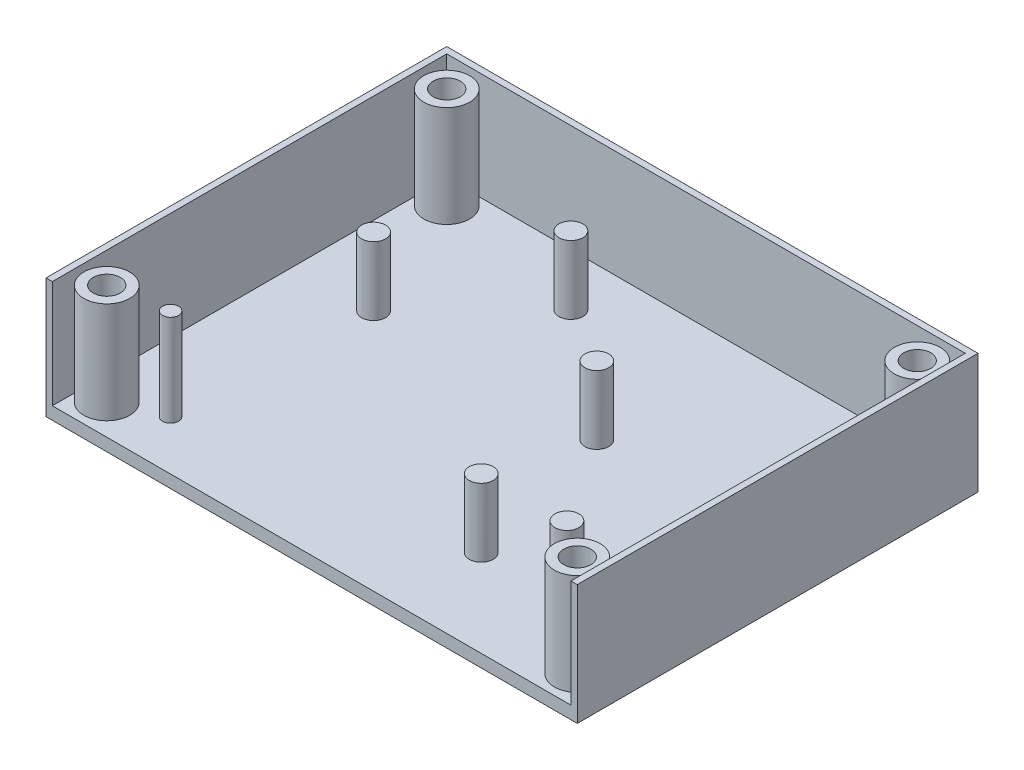
from build123d import *

# Parameters (mm, degrees)
BOSS_EXTRUDE12_DEPTH = 3.175
BOSS_EXTRUDE13_DEPTH = 30.1625
SKETCH1_25_R         = 5.75
SKETCH1_25_R_2       = 3.4
BOSS_EXTRUDE15_DEPTH = 28.575
SKETCH1_27_R         = 3.4
CUT_EXTRUDE3_DEPTH   = 28.575
CHAMFER2_SIZE        = 1.45
SKETCH1_28_R         = 3
BOSS_EXTRUDE16_DEPTH = 20.32
SKETCH1_29_R         = 2
BOSS_EXTRUDE17_DEPTH = 26.1874


with BuildPart() as part:
    # Sketch1 → Boss-Extrude12 (new body)
    with BuildSketch(Plane(origin=(0, 0, 0), x_dir=(1, 0, 0), z_dir=(0, 1, 0))):
        Polygon((-66.858315384, -50.276221126), (-65.270815384, -50.276221126), (64.85543465, -50.276221126), (66.44293465, -50.276221126), (66.44293465, 50.266274766), (-66.858315384, 50.266274766), align=None)
    extrude(amount=BOSS_EXTRUDE12_DEPTH)

    # Sketch1<23> → Boss-Extrude13 (add)
    with BuildSketch(Plane(origin=(0, 0, 0), x_dir=(1, 0, 0), z_dir=(0, 1, 0))):
        Polygon((-66.858315384, 50.266274766), (-66.858315384, -50.276221126), (-65.270815384, -50.276221126), (-65.270815384, 48.678774766), (64.85543465, 48.678774766), (64.85543465, -50.276221126), (66.44293465, -50.276221126), (66.44293465, 50.266274766), align=None)
    extrude(amount=BOSS_EXTRUDE13_DEPTH)

    # Sketch1<25> → Boss-Extrude15 (add)
    # profile 1 of 4: a face of its own
    with BuildSketch(Plane(origin=(0, 0, 0), x_dir=(1, 0, 0), z_dir=(0, 1, 0))):
        with Locations((-59.238315384, 42.646274766)):
            Circle(SKETCH1_25_R)
        with Locations((-59.238315384, 42.646274766)):
            Circle(SKETCH1_25_R_2, mode=Mode.SUBTRACT)
    # profile 2 of 4: a face of its own
    with BuildSketch(Plane(origin=(0, 0, 0), x_dir=(1, 0, 0), z_dir=(0, 1, 0))):
        with Locations((58.82293465, 42.646274766)):
            Circle(SKETCH1_25_R)
        with Locations((58.82293465, 42.646274766)):
            Circle(SKETCH1_25_R_2, mode=Mode.SUBTRACT)
    # profile 3 of 4: a face of its own
    with BuildSketch(Plane(origin=(0, 0, 0), x_dir=(1, 0, 0), z_dir=(0, 1, 0))):
        with Locations((-59.238315384, -42.656221126)):
            Circle(SKETCH1_25_R)
        with Locations((-59.238315384, -42.656221126)):
            Circle(SKETCH1_25_R_2, mode=Mode.SUBTRACT)
    # profile 4 of 4: a face of its own
    with BuildSketch(Plane(origin=(0, 0, 0), x_dir=(1, 0, 0), z_dir=(0, 1, 0))):
        with Locations((58.82293465, -42.656221126)):
            Circle(SKETCH1_25_R)
        with Locations((58.82293465, -42.656221126)):
            Circle(SKETCH1_25_R_2, mode=Mode.SUBTRACT)
    extrude(amount=BOSS_EXTRUDE15_DEPTH)

    # Sketch1<27> → Cut-Extrude3 (cut)
    with BuildSketch(Plane(origin=(0, 0, 0), x_dir=(1, 0, 0), z_dir=(0, 1, 0))):
        with Locations((-59.238315384, 42.646274766)):
            Circle(SKETCH1_27_R)
        with Locations((58.82293465, 42.646274766)):
            Circle(SKETCH1_27_R)
        with Locations((-59.238315384, -42.656221126)):
            Circle(SKETCH1_27_R)
        with Locations((58.82293465, -42.656221126)):
            Circle(SKETCH1_27_R)
    extrude(amount=CUT_EXTRUDE3_DEPTH, mode=Mode.SUBTRACT)

    # Chamfer2
    chamfer2_edges = [part.edges().sort_by_distance(p)[0] for p in [
        (55.42293465, 0, 42.656221126),
        (55.42293465, 0, -42.646274766),
        (-62.638315384, 0, 42.656221126),
        (-62.638315384, 0, -42.646274766),
    ]]
    chamfer(chamfer2_edges, length=CHAMFER2_SIZE)

    # Sketch1<28> → Boss-Extrude16 (add)
    with BuildSketch(Plane(origin=(0, 0, 0), x_dir=(1, 0, 0), z_dir=(0, 1, 0))):
        with Locations((-21.087205302, 35.652944211)):
            Circle(SKETCH1_28_R)
        with Locations((20.412794756, -28.347055805)):
            Circle(SKETCH1_28_R)
        with Locations((-45.587205324, 10.652944173)):
            Circle(SKETCH1_28_R)
        with Locations((10.41279469, 10.652944173)):
            Circle(SKETCH1_28_R)
        with Locations((41.412794666, -27.847055789)):
            Circle(SKETCH1_28_R)
    extrude(amount=BOSS_EXTRUDE16_DEPTH)

    # Sketch1<29> → Boss-Extrude17 (add)
    with BuildSketch(Plane(origin=(0, 0, 0), x_dir=(1, 0, 0), z_dir=(0, 1, 0))):
        with Locations((-48.051200616, -37.823742724)):
            Circle(SKETCH1_29_R)
    extrude(amount=BOSS_EXTRUDE17_DEPTH)


solid = part.part
